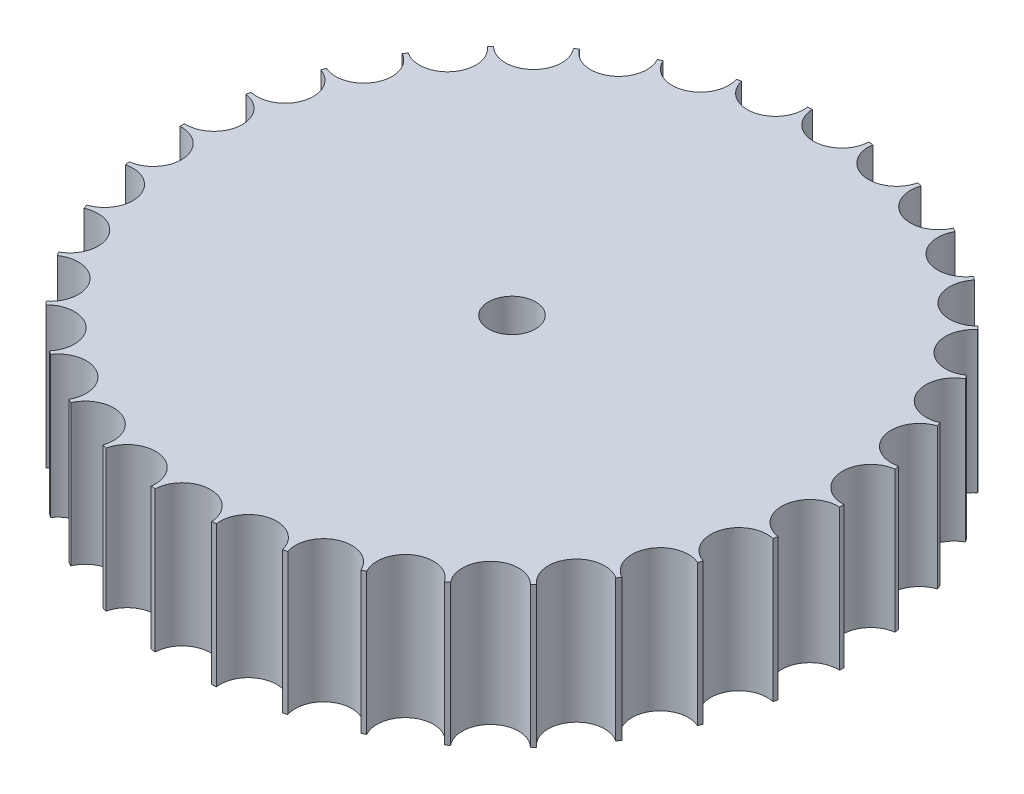
from build123d import *

# Parameters (mm, degrees)
SKETCH1_R           = 2.5
BOSS_EXTRUDE1_DEPTH = 15


with BuildPart() as part:
    # Sketch1 → Boss-Extrude1 (new body)
    with BuildSketch(Plane(origin=(0, 0, 0), x_dir=(1, 0, 0), z_dir=(0, 1, 0))):
        with BuildLine():
            ThreePointArc((2.997243632, 34.871428571), (0, 32), (-2.997243632, 34.871428571))
            ThreePointArc((-2.997243632, 34.871428571), (-3.229392581, 34.85069617), (-3.461398322, 34.828418305))
            ThreePointArc((-3.461398322, 34.828418305), (-5.87998457, 31.45513919), (-9.353818049, 33.726934161))
            ThreePointArc((-9.353818049, 33.726934161), (-9.578204653, 33.663897511), (-9.802166508, 33.599368026))
            ThreePointArc((-9.802166508, 33.599368026), (-11.559733318, 29.839111341), (-15.391859411, 31.433909459))
            ThreePointArc((-15.391859411, 31.433909459), (-15.600842452, 31.330715197), (-15.80913367, 31.226131567))
            ThreePointArc((-15.80913367, 31.226131567), (-16.845829212, 27.206948343), (-20.905749461, 28.070440671))
            ThreePointArc((-20.905749461, 28.070440671), (-21.092212273, 27.930602955), (-21.277739745, 27.789526648))
            ThreePointArc((-21.277739745, 27.789526648), (-21.558260597, 23.648285351), (-25.707719287, 23.751066693))
            ThreePointArc((-25.707719287, 23.751066693), (-25.865312103, 23.579347528), (-26.021757914, 23.40658273))
            ThreePointArc((-26.021757914, 23.40658273), (-25.536551273, 19.284308364), (-29.634243566, 18.622878625))
            ThreePointArc((-29.634243566, 18.622878625), (-29.757599751, 18.425125701), (-29.879636326, 18.226555709))
            ThreePointArc((-29.879636326, 18.226555709), (-28.645225323, 14.263627385), (-32.551609223, 12.860510761))
            ThreePointArc((-32.551609223, 12.860510761), (-32.636528029, 12.643458317), (-32.71999956, 12.425845195))
            ThreePointArc((-32.71999956, 12.425845195), (-30.778420582, 8.757215682), (-34.360468868, 6.660193627))
            ThreePointArc((-34.360468868, 6.660193627), (-34.404058489, 6.431233124), (-34.446122452, 6.201987425))
            ThreePointArc((-34.446122452, 6.201987425), (-31.863493641, 2.952587503), (-34.999223958, 0.233071588))
            ThreePointArc((-34.999223958, 0.233071588), (-35, 0), (-34.999223958, -0.233071588))
            ThreePointArc((-34.999223958, -0.233071588), (-31.863493641, -2.952587503), (-34.446122452, -6.201987425))
            ThreePointArc((-34.446122452, -6.201987425), (-34.404058489, -6.431233124), (-34.360468868, -6.660193627))
            ThreePointArc((-34.360468868, -6.660193627), (-30.778420582, -8.757215682), (-32.71999956, -12.425845195))
            ThreePointArc((-32.71999956, -12.425845195), (-32.636528029, -12.643458317), (-32.551609223, -12.860510761))
            ThreePointArc((-32.551609223, -12.860510761), (-28.645225323, -14.263627385), (-29.879636326, -18.226555709))
            ThreePointArc((-29.879636326, -18.226555709), (-29.757599751, -18.425125701), (-29.634243566, -18.622878625))
            ThreePointArc((-29.634243566, -18.622878625), (-25.536551273, -19.284308364), (-26.021757914, -23.40658273))
            ThreePointArc((-26.021757914, -23.40658273), (-25.865312103, -23.579347528), (-25.707719287, -23.751066693))
            ThreePointArc((-25.707719287, -23.751066693), (-21.558260597, -23.648285351), (-21.277739745, -27.789526648))
            ThreePointArc((-21.277739745, -27.789526648), (-21.092212273, -27.930602955), (-20.905749461, -28.070440671))
            ThreePointArc((-20.905749461, -28.070440671), (-16.845829212, -27.206948343), (-15.80913367, -31.226131567))
            ThreePointArc((-15.80913367, -31.226131567), (-15.600842452, -31.330715197), (-15.391859411, -31.433909459))
            ThreePointArc((-15.391859411, -31.433909459), (-11.559733318, -29.839111341), (-9.802166508, -33.599368026))
            ThreePointArc((-9.802166508, -33.599368026), (-9.578204653, -33.663897511), (-9.353818049, -33.726934161))
            ThreePointArc((-9.353818049, -33.726934161), (-5.87998457, -31.45513919), (-3.461398322, -34.828418305))
            ThreePointArc((-3.461398322, -34.828418305), (-3.229392581, -34.85069617), (-2.997243632, -34.871428571))
            ThreePointArc((-2.997243632, -34.871428571), (0, -32), (2.997243632, -34.871428571))
            ThreePointArc((2.997243632, -34.871428571), (3.229392581, -34.85069617), (3.461398322, -34.828418305))
            ThreePointArc((3.461398322, -34.828418305), (5.87998457, -31.45513919), (9.353818049, -33.726934161))
            ThreePointArc((9.353818049, -33.726934161), (9.578204653, -33.663897511), (9.802166508, -33.599368026))
            ThreePointArc((9.802166508, -33.599368026), (11.559733318, -29.839111341), (15.391859411, -31.433909459))
            ThreePointArc((15.391859411, -31.433909459), (15.600842452, -31.330715197), (15.80913367, -31.226131567))
            ThreePointArc((15.80913367, -31.226131567), (16.845829212, -27.206948343), (20.905749461, -28.070440671))
            ThreePointArc((20.905749461, -28.070440671), (21.092212273, -27.930602955), (21.277739745, -27.789526648))
            ThreePointArc((21.277739745, -27.789526648), (21.558260597, -23.648285351), (25.707719287, -23.751066693))
            ThreePointArc((25.707719287, -23.751066693), (25.865312103, -23.579347528), (26.021757914, -23.40658273))
            ThreePointArc((26.021757914, -23.40658273), (25.536551273, -19.284308364), (29.634243566, -18.622878625))
            ThreePointArc((29.634243566, -18.622878625), (29.757599751, -18.425125701), (29.879636326, -18.226555709))
            ThreePointArc((29.879636326, -18.226555709), (28.645225323, -14.263627385), (32.551609223, -12.860510761))
            ThreePointArc((32.551609223, -12.860510761), (32.636528029, -12.643458317), (32.71999956, -12.425845195))
            ThreePointArc((32.71999956, -12.425845195), (30.778420582, -8.757215682), (34.360468868, -6.660193627))
            ThreePointArc((34.360468868, -6.660193627), (34.404058489, -6.431233124), (34.446122452, -6.201987425))
            ThreePointArc((34.446122452, -6.201987425), (31.863493641, -2.952587503), (34.999223958, -0.233071588))
            ThreePointArc((34.999223958, -0.233071588), (34.999805989, -0.11653644), (35, 0))
            ThreePointArc((35, 0), (34.999805989, 0.11653644), (34.999223958, 0.233071588))
            ThreePointArc((34.999223958, 0.233071588), (31.863493641, 2.952587503), (34.446122452, 6.201987425))
            ThreePointArc((34.446122452, 6.201987425), (34.404058489, 6.431233124), (34.360468868, 6.660193627))
            ThreePointArc((34.360468868, 6.660193627), (30.778420582, 8.757215682), (32.71999956, 12.425845195))
            ThreePointArc((32.71999956, 12.425845195), (32.636528029, 12.643458317), (32.551609223, 12.860510761))
            ThreePointArc((32.551609223, 12.860510761), (28.645225323, 14.263627385), (29.879636326, 18.226555709))
            ThreePointArc((29.879636326, 18.226555709), (29.757599751, 18.425125701), (29.634243566, 18.622878625))
            ThreePointArc((29.634243566, 18.622878625), (25.536551273, 19.284308364), (26.021757914, 23.40658273))
            ThreePointArc((26.021757914, 23.40658273), (25.865312103, 23.579347528), (25.707719287, 23.751066693))
            ThreePointArc((25.707719287, 23.751066693), (21.558260597, 23.648285351), (21.277739745, 27.789526648))
            ThreePointArc((21.277739745, 27.789526648), (21.092212273, 27.930602955), (20.905749461, 28.070440671))
            ThreePointArc((20.905749461, 28.070440671), (16.845829212, 27.206948343), (15.80913367, 31.226131567))
            ThreePointArc((15.80913367, 31.226131567), (15.600842452, 31.330715197), (15.391859411, 31.433909459))
            ThreePointArc((15.391859411, 31.433909459), (11.559733318, 29.839111341), (9.802166508, 33.599368026))
            ThreePointArc((9.802166508, 33.599368026), (9.578204653, 33.663897511), (9.353818049, 33.726934161))
            ThreePointArc((9.353818049, 33.726934161), (5.87998457, 31.45513919), (3.461398322, 34.828418305))
            ThreePointArc((3.461398322, 34.828418305), (3.229392581, 34.85069617), (2.997243632, 34.871428571))
        make_face()
        Circle(SKETCH1_R, mode=Mode.SUBTRACT)
    extrude(amount=BOSS_EXTRUDE1_DEPTH)


solid = part.part
